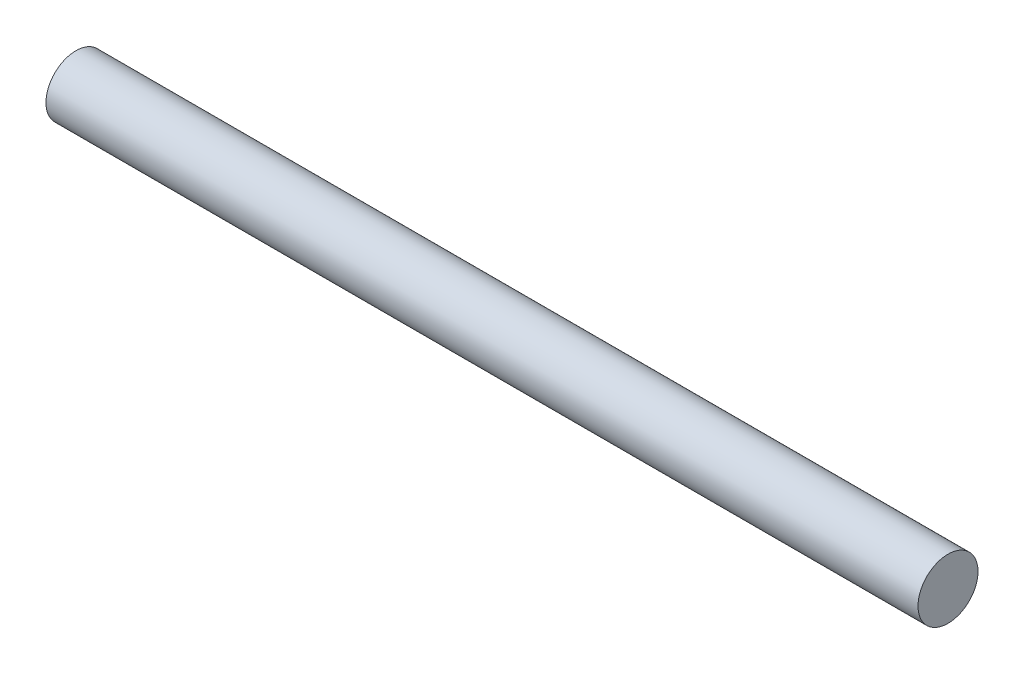
from build123d import *

# Parameters (mm, degrees)
SKETCH1_R           = 3
BOSS_EXTRUDE1_DEPTH = 87.2


with BuildPart() as part:
    # Sketch1 → Boss-Extrude1 (new body)
    with BuildSketch(Plane(origin=(0, 0, 0), x_dir=(0, 0, -1), z_dir=(1, 0, 0))):
        Circle(SKETCH1_R)
    extrude(amount=BOSS_EXTRUDE1_DEPTH)


solid = part.part
